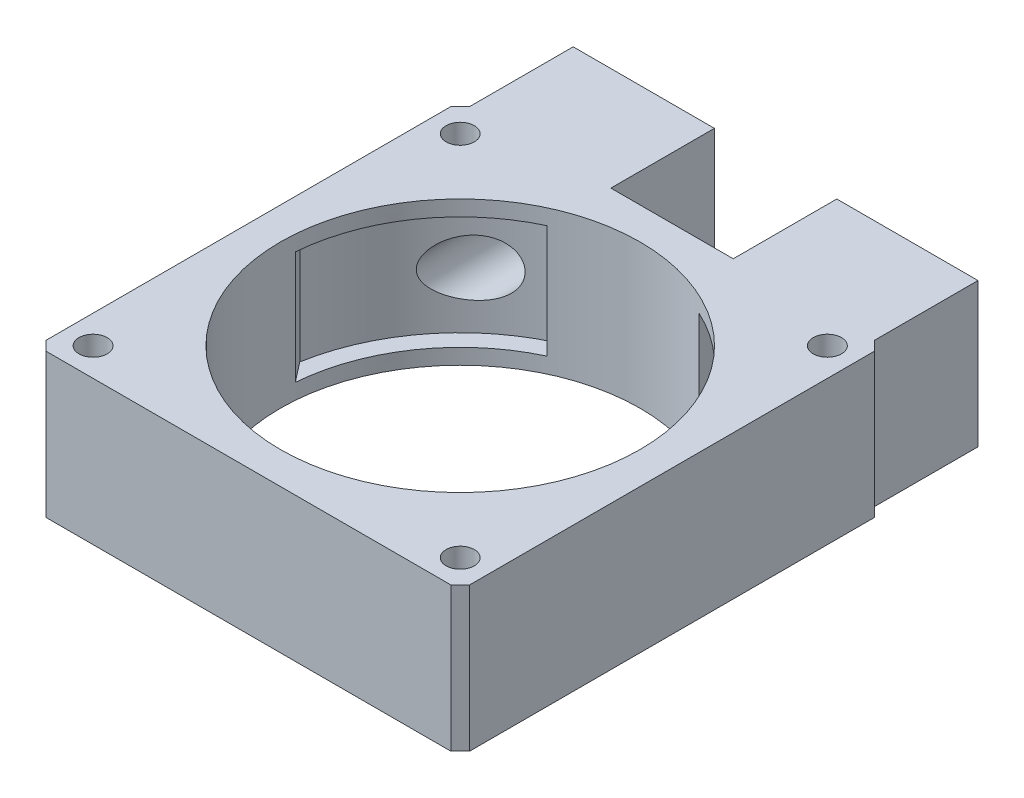
from build123d import *

# Parameters (mm, degrees)
SKETCH_1_W               = 45
SKETCH_1_H               = 45
EXTRUDE_1_DEPTH          = 15.3
SKETCH_2_R               = 19.1
CUT_EXTRUDE_1_DEPTH      = 36.307081443
SKETCH_5_W               = 15
SKETCH_5_H               = 15.3
EXTRUDE_2_DEPTH          = 12
SKETCH_6_R               = 3
CUT_EXTRUDE_4_DEPTH      = 35
SKETCH_7_R               = 1.5
CUT_EXTRUDE_5_DEPTH      = 44.938479832
CUT_EXTRUDE_6_DEPTH      = 6
CUT_EXTRUDE_6_DEPTH_BACK = 6
SKETCH_9_R               = 4.25
CUT_EXTRUDE_7_DEPTH      = 12
CHAMFER_2_SIZE           = 1
CHAMFER_3_SIZE           = 1
CHAMFER_4_SIZE           = 1


# Some blends are built 0.0001 mm under size
with BuildPart() as part:
    # 草图1 → 凸台-拉伸1 (new body)
    with BuildSketch(Plane(origin=(0, 0, 0), x_dir=(1, 0, 0), z_dir=(0, 1, 0))):
        Rectangle(SKETCH_1_W, SKETCH_1_H)
    extrude(amount=EXTRUDE_1_DEPTH)

    # 草图2 → 切除-拉伸1 (cut, through all)
    with BuildSketch(Plane(origin=(0, 15.3, 0), x_dir=(1, 0, 0), z_dir=(0, 1, 0))):
        with Locations(Location((0, 0, 0), (0, 0, 270))):
            Circle(SKETCH_2_R)
    extrude(amount=-CUT_EXTRUDE_1_DEPTH, mode=Mode.SUBTRACT)

    # 草图5 → 凸台-拉伸2 (add)
    with BuildSketch(Plane(origin=(0, 0, -22.5), x_dir=(-1, 0, 0), z_dir=(0, 0, -1))):
        with Locations((14, 7.65)):
            Rectangle(SKETCH_5_W, SKETCH_5_H)
        with Locations((-14, 7.65)):
            Rectangle(SKETCH_5_W, SKETCH_5_H)
    extrude(amount=EXTRUDE_2_DEPTH)

    # 草图6 → 切除-拉伸4 (cut)
    with BuildSketch(Plane(origin=(0, 0, -34.5), x_dir=(-1, 0, 0), z_dir=(0, 0, -1))):
        with Locations((-14, 7.65)):
            Circle(SKETCH_6_R)
        with Locations((14, 7.65)):
            Circle(SKETCH_6_R)
    extrude(amount=-CUT_EXTRUDE_4_DEPTH, mode=Mode.SUBTRACT)

    # 草图7 → 切除-拉伸5 (cut, through all)
    with BuildSketch(Plane(origin=(0, 15.3, 0), x_dir=(1, 0, 0), z_dir=(0, 1, 0))):
        with Locations(Location((-19.5, 19.5, 0), (0, 0, 270))):
            Circle(SKETCH_7_R)
        with Locations(Location((19.5, 19.5, 0), (0, 0, 90))):
            Circle(SKETCH_7_R)
        with Locations(Location((19.5, -19.5, 0), (0, 0, 270))):
            Circle(SKETCH_7_R)
        with Locations(Location((-19.5, -19.5, 0), (0, 0, 90))):
            Circle(SKETCH_7_R)
    extrude(amount=-CUT_EXTRUDE_5_DEPTH, mode=Mode.SUBTRACT)

    # 草图8 → 切除-拉伸6 (cut, two sides: drawn at the far end of the back side and taken through both)
    with BuildSketch(Plane(origin=(0, 7.65, 0), x_dir=(-1, 0, 0), z_dir=(0, -1, 0)).offset(-CUT_EXTRUDE_6_DEPTH_BACK)):
        with BuildLine():
            Line((-8.874983497, 19.032463528), (-8.072008799, 17.310478732))
            ThreePointArc((-8.072008799, 17.310478732), (-15.1530488, 11.627343294), (-18.809828083, 3.316680193))
            Line((-18.809828083, 3.316680193), (-20.680962813, 3.646611731))
            ThreePointArc((-20.680962813, 3.646611731), (-16.660420146, 12.783990009), (-8.874983497, 19.032463528))
        make_face()
        with BuildLine():
            Line((20.680962813, 3.646611731), (18.809828083, 3.316680193))
            ThreePointArc((18.809828083, 3.316680193), (15.1530488, 11.627343294), (8.072008799, 17.310478732))
            Line((8.072008799, 17.310478732), (8.874983497, 19.032463528))
            ThreePointArc((8.874983497, 19.032463528), (16.660420146, 12.783990009), (20.680962813, 3.646611731))
        make_face()
    extrude(amount=CUT_EXTRUDE_6_DEPTH + CUT_EXTRUDE_6_DEPTH_BACK, mode=Mode.SUBTRACT)

    # 草图9 → 切除-拉伸7 (cut)
    with BuildSketch(Plane(origin=(0, 0, -34.5), x_dir=(-1, 0, 0), z_dir=(0, 0, -1))):
        with Locations((-14, 7.65)):
            Circle(SKETCH_9_R)
        with Locations((14, 7.65)):
            Circle(SKETCH_9_R)
    extrude(amount=-CUT_EXTRUDE_7_DEPTH, mode=Mode.SUBTRACT)

    # 倒角1
    # the kernel refuses this chamfer: 2 mm, written as the material it takes off along each edge
    with BuildSketch(Plane(origin=(-18.809828083, 1.65, -3.316680193), x_dir=(-0.09666023054018325, 0, 0.9953174367165073), z_dir=(0, 1, 0))) as chamfer_1_piece_1_section:
        with BuildLine():
            Line((1.811638226, -0.054831322), (-0.147910468, -1.899248595))
            Line((-0.147910468, -1.899248595), (0, 0))
            ThreePointArc((0, 0), (0.933514183, -0.049753736), (1.811638226, -0.054831322))
        make_face()
    chamfer_1_piece_1 = extrude(amount=12, mode=Mode.PRIVATE)
    chamfer_1_piece_1 = chamfer_1_piece_1 & Plane(origin=(0, 7.65, 0), x_dir=(-0.42261826174070266, 0, -0.9063077870366485), z_dir=(0, 1, 0)) * Cylinder(21, 32, mode=Mode.PRIVATE)
    add(chamfer_1_piece_1, mode=Mode.SUBTRACT)
    with BuildSketch(Plane(origin=(18.809828083, 13.65, -3.316680193), x_dir=(0.09666023054018283, 0, 0.9953174367165073), z_dir=(0, -1, 0))) as chamfer_1_piece_2_section:
        with BuildLine():
            Line((1.811638226, -0.054831322), (-0.147910468, -1.899248595))
            Line((-0.147910468, -1.899248595), (0, 0))
            ThreePointArc((0, 0), (0.933514183, -0.049753736), (1.811638226, -0.054831322))
        make_face()
    chamfer_1_piece_2 = extrude(amount=12, mode=Mode.PRIVATE)
    chamfer_1_piece_2 = chamfer_1_piece_2 & Plane(origin=(0, 7.65, 0), x_dir=(0.9848077530122075, 0, -0.17364817766693397), z_dir=(0, 1, 0)) * Cylinder(21, 32, mode=Mode.PRIVATE)
    add(chamfer_1_piece_2, mode=Mode.SUBTRACT)

    # 倒角2
    chamfer_2_edges = [part.edges().sort_by_distance(p)[0] for p in [
        (22.5, 7.65, 22.5),
        (-22.5, 7.65, 22.5),
        (-22.5, 7.65, -22.5),
        (22.5, 7.65, -22.5),
    ]]
    chamfer(chamfer_2_edges, length=CHAMFER_2_SIZE - 0.0001)  # a hair under: the kernel refuses the full size

    # 倒角3
    chamfer_3_edges = [part.edges().sort_by_distance(p)[0] for p in [
        (18.25, 7.65, -22.5),
        (-9.75, 7.65, -22.5),
    ]]
    chamfer(chamfer_3_edges, length=CHAMFER_3_SIZE)

    # 倒角4
    chamfer_4_edges = [part.edges().sort_by_distance(p)[0] for p in [
        (6.5, 7.65, -34.5),
        (14, 15.3, -34.5),
        (21.5, 7.65, -34.5),
        (14, 0, -34.5),
        (-21.5, 7.65, -34.5),
        (-14, 15.3, -34.5),
        (-6.5, 7.65, -34.5),
        (-14, 0, -34.5),
    ]]
    chamfer(chamfer_4_edges, length=CHAMFER_4_SIZE)


solid = part.part
